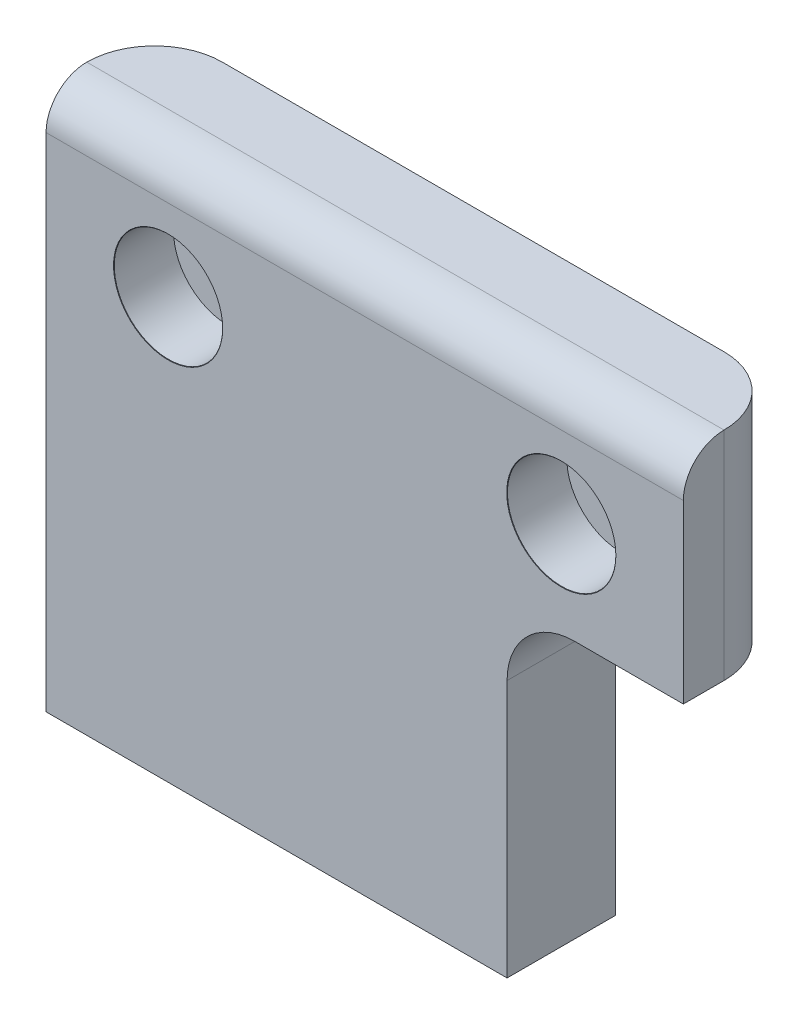
from build123d import *

# Parameters (mm, degrees)
SKETCH1_W                                    = 47
SKETCH1_H                                    = 8
BOSS_EXTRUDE1_DEPTH                          = 40
FILLET1_R                                    = 3
FILLET2_R                                    = 5
CBORE_FOR_M4_HEX_SOCKET_HEAD_CAP_SCR_2_COUNT = 2
CBORE_FOR_M4_HEX_SOCKET_HEAD_CAP_SCR_2_PITCH = 29
CUT_EXTRUDE1_REACH                           = 49.077
SKETCH5_W                                    = 13
SKETCH5_H                                    = 23.997787144
FILLET3_R                                    = 5


with BuildPart() as part:
    # Sketch1 → Boss-Extrude1 (new body)
    with BuildSketch(Plane(origin=(0, 0, 0), x_dir=(1, 0, 0), z_dir=(0, 1, 0))):
        Rectangle(SKETCH1_W, SKETCH1_H)
    extrude(amount=-BOSS_EXTRUDE1_DEPTH)

    # Fillet1
    fillet1_edges = [part.edges().sort_by_distance(p)[0] for p in [
        (0, 0, 4),
    ]]
    fillet(fillet1_edges, radius=FILLET1_R)

    # Fillet2
    fillet2_edges = [part.edges().sort_by_distance(p)[0] for p in [
        (-23.5, -20, -4),
        (23.5, -20, -4),
    ]]
    fillet(fillet2_edges, radius=FILLET2_R)

    # Sketch3 → CBORE for M4 Hex Socket Head Cap Screw1 (revolve, cut)
    with BuildSketch(Plane(origin=(-14.5, -9, 4), x_dir=(0, -1, 0), z_dir=(1, 0, 0))):
        Polygon((0, 0), (0, 8), (2.15, 8), (2.15, 4.4), (4, 4.4), (4, 0.025), (4.025, 0), align=None)
    cbore_for_m4_hex_socket_head_cap_screw1 = revolve(axis=Axis((-14.5, -9, 10.35), (0, 0, -1)), mode=Mode.SUBTRACT)

    # CBORE for M4 Hex Socket Head Cap Scr 2: CBORE for M4 Hex Socket Head Cap Screw1 ×2
    with Locations(*[(i * CBORE_FOR_M4_HEX_SOCKET_HEAD_CAP_SCR_2_PITCH, 0, 0) for i in range(1, CBORE_FOR_M4_HEX_SOCKET_HEAD_CAP_SCR_2_COUNT)]):
        add(cbore_for_m4_hex_socket_head_cap_screw1, mode=Mode.SUBTRACT)

    # Sketch5 → Cut-Extrude1 (cut, up to next)
    with BuildSketch(Plane.XY.offset(4), mode=Mode.PRIVATE) as cut_extrude1_sk1:
        with Locations((17, -28.001106428)):
            Rectangle(SKETCH5_W, SKETCH5_H)
    cut_extrude1_tool1 = extrude(cut_extrude1_sk1.sketch, amount=-CUT_EXTRUDE1_REACH, mode=Mode.PRIVATE) & part.part
    add(cut_extrude1_tool1.solids().sort_by_distance((17, -28.001106, 4))[0], mode=Mode.SUBTRACT)

    # Fillet3
    fillet3_edges = [part.edges().sort_by_distance(p)[0] for p in [
        (10.5, -16.002212856, 0),
    ]]
    fillet(fillet3_edges, radius=FILLET3_R)


solid = part.part
